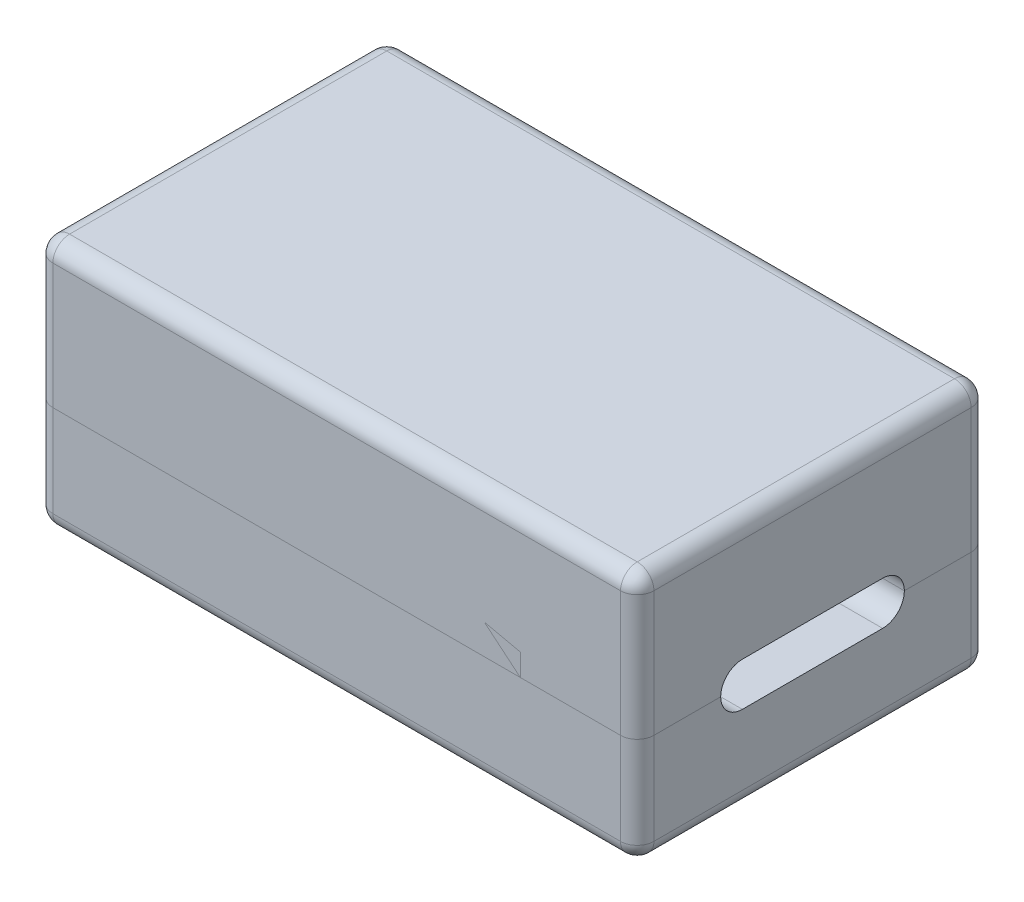
from build123d import *

# Parameters (mm, degrees)
SKETCH1_W           = 36
SKETCH1_H           = 21
BOSS_EXTRUDE2_DEPTH = 15
CUT_EXTRUDE1_DEPTH  = 15
SKETCH5_W           = 30
SKETCH5_H           = 15
CUT_EXTRUDE2_DEPTH  = 3.5
SKETCH7_W           = 30
SKETCH7_H           = 15
CUT_EXTRUDE3_DEPTH  = 5.5
FILLET1_R           = 1
FILLET2_R           = 1
SKETCH9_W           = 3
SKETCH9_H           = 3
BOSS_EXTRUDE3_DEPTH = 1
SKETCH9_4_W         = 3
SKETCH9_4_H         = 3
BOSS_EXTRUDE4_DEPTH = 1
SKETCH10_W          = 3
SKETCH10_H          = 1.5
BOSS_EXTRUDE5_DEPTH = 1
CUT_EXTRUDE4_DEPTH  = 35.296501279
SKETCH12_W          = 3
SKETCH12_H          = 6
BOSS_EXTRUDE6_DEPTH = 0.5
FILLET3_R           = 11
FILLET4_R           = 0.5
SKETCH17_W          = 3
SKETCH17_H          = 2
BOSS_EXTRUDE7_DEPTH = 1
SKETCH18_W          = 3
SKETCH18_H          = 1.5
BOSS_EXTRUDE8_DEPTH = 1
FILLET5_R           = 0.75
FILLET6_SIZE        = 1


# Some blends are built 0.0001 mm under size
with BuildPart() as part:
    # Sketch1 → Boss-Extrude2 (new body)
    with BuildSketch(Plane(origin=(0, 0, 0), x_dir=(1, 0, 0), z_dir=(0, 1, 0))):
        Rectangle(SKETCH1_W, SKETCH1_H)
    extrude(amount=BOSS_EXTRUDE2_DEPTH)

    # Sketch2 → Cut-Extrude1 (cut)
    with BuildSketch(Plane(origin=(18, 0, 0), x_dir=(0, 0, -1), z_dir=(1, 0, 0))):
        with BuildLine():
            Line((-4.2, 7.8), (4.2, 7.8))
            ThreePointArc((4.2, 7.8), (5.5, 6.5), (4.2, 5.2))
            Line((4.2, 5.2), (-4.2, 5.2))
            ThreePointArc((-4.2, 5.2), (-5.5, 6.5), (-4.2, 7.8))
        make_face()
    extrude(amount=-CUT_EXTRUDE1_DEPTH, mode=Mode.SUBTRACT)


with BuildPart() as body_2:
    # Split1: the piece on the far side of the plane
    add(part.part)
    split(bisect_by=Plane.ZX.offset(6.5), keep=Keep.BOTTOM)

    # Sketch5 → Cut-Extrude2 (cut)
    with BuildSketch(Plane(origin=(0, 6.5, 0), x_dir=(1, 0, 0), z_dir=(0, 1, 0))):
        Rectangle(SKETCH5_W, SKETCH5_H)
    extrude(amount=-CUT_EXTRUDE2_DEPTH, mode=Mode.SUBTRACT)

    # Fillet2
    fillet2_edges = [body_2.edges().sort_by_distance(p)[0] for p in [
        (18, 0, 0),
        (0, 0, -10.5),
        (-18, 0, 0),
        (0, 0, 10.5),
        (18, 3.25, 10.5),
        (-18, 3.25, 10.5),
        (-18, 3.25, -10.5),
        (18, 3.25, -10.5),
    ]]
    fillet(fillet2_edges, radius=FILLET2_R)

    # Sketch9 → Boss-Extrude3 (add)
    with BuildSketch(Plane.XY.offset(10.5)):
        with Locations((-9.5, 8)):
            Rectangle(SKETCH9_W, SKETCH9_H)
    extrude(amount=-BOSS_EXTRUDE3_DEPTH)

    # Sketch9<4> → Boss-Extrude4 (add)
    with BuildSketch(Plane.XY.offset(10.5)):
        with Locations((9.5, 8)):
            Rectangle(SKETCH9_4_W, SKETCH9_4_H)
    extrude(amount=-BOSS_EXTRUDE4_DEPTH)

    # Sketch10 → Boss-Extrude5 (add)
    with BuildSketch(Plane(origin=(0, 0, 9.5), x_dir=(-1, 0, 0), z_dir=(0, 0, -1))):
        with Locations((-9.5, 8.75)):
            Rectangle(SKETCH10_W, SKETCH10_H)
        with Locations((9.5, 8.75)):
            Rectangle(SKETCH10_W, SKETCH10_H)
    extrude(amount=BOSS_EXTRUDE5_DEPTH)

    # Sketch11 → Cut-Extrude4 (cut, through all)
    with BuildSketch(Plane(origin=(11, 0, 0), x_dir=(0, 0, -1), z_dir=(1, 0, 0))):
        Polygon((-9.5, 9.5), (-8.5, 8), (-8.5, 9.5), align=None)
    extrude(amount=-CUT_EXTRUDE4_DEPTH, mode=Mode.SUBTRACT)

    # Sketch12 → Boss-Extrude6 (add, symmetric)
    with BuildSketch(Plane(origin=(0, 0, -10.5), x_dir=(-1, 0, 0), z_dir=(0, 0, -1))):
        with Locations((0, 6.5)):
            Rectangle(SKETCH12_W, SKETCH12_H)
    extrude(amount=BOSS_EXTRUDE6_DEPTH, both=True)

    # Fillet3
    # the kernel refuses this fillet: 11 mm, written as the material it takes off along each edge
    with BuildSketch(Plane(origin=(-9.696798155, 3.5, -11), x_dir=(0, 0, 1), z_dir=(1, 0, 0))) as fillet3_piece_1:
        with BuildLine():
            CenterArc((11, -3.278719262), FILLET3_R, 162.658557197, 17.341442803)
            Line((0, -3.278719262), (-0.22, -3.278719262))
            Line((-0.22, -3.278719262), (-0.22, 0))
            Line((-0.22, 0), (0, 0.22))
            ThreePointArc((0, 0.22), (0.25, 0.22), (0.29, 0.065574385))
            Line((0.29, 0.065574385), (0.5, 0))
        make_face()
    extrude(amount=19.393596311, mode=Mode.SUBTRACT)

    # Fillet4
    fillet4_edges = [body_2.edges().sort_by_distance(p)[0] for p in [
        (-9.5, 9.5, 9.5),
        (9.5, 9.5, 9.5),
        (-9.5, 9.5, 10.5),
        (9.5, 9.5, 10.5),
    ]]
    fillet(fillet4_edges, radius=FILLET4_R)

    # Sketch17 → Boss-Extrude7 (add)
    with BuildSketch(Plane.XY.offset(-10)):
        with Locations((0, 10.5)):
            Rectangle(SKETCH17_W, SKETCH17_H)
    extrude(amount=-BOSS_EXTRUDE7_DEPTH)

    # Sketch18 → Boss-Extrude8 (add)
    with BuildSketch(Plane.XY.offset(-10)):
        with Locations((0, 9.25)):
            Rectangle(SKETCH18_W, SKETCH18_H)
    extrude(amount=BOSS_EXTRUDE8_DEPTH)

    # Fillet5
    fillet5_edges = [body_2.edges().sort_by_distance(p)[0] for p in [
        (0, 8.5, -9),
        (0, 10, -9),
    ]]
    fillet(fillet5_edges, radius=FILLET5_R - 0.0001)  # a hair under: the kernel refuses the full size

    # Fillet6
    # a fillet whose section is not a circle: 1 mm, written as the material it takes off along each edge
    with BuildSketch(Plane(origin=(4, 11.5, -10), x_dir=(0, -1, 0), z_dir=(-1, 0, 0))) as fillet6_piece_1:
        with BuildLine():
            Bezier((FILLET6_SIZE, 0), (0, 0), (0, -FILLET6_SIZE), weights=[1, 0.070710678, 1])
            Line((0, -FILLET6_SIZE), (0, 0))
            Line((0, 0), (FILLET6_SIZE, 0))
        make_face()
    extrude(amount=8, mode=Mode.SUBTRACT)


with BuildPart() as part_1:
    add(part.part)

    # Split1
    split(bisect_by=Plane.ZX.offset(6.5), keep=Keep.TOP)

    # Sketch7 → Cut-Extrude3 (cut)
    with BuildSketch(Plane.XZ.offset(-6.5)):
        Rectangle(SKETCH7_W, SKETCH7_H)
    extrude(amount=-CUT_EXTRUDE3_DEPTH, mode=Mode.SUBTRACT)

    # Fillet1
    fillet1_edges = [part_1.edges().sort_by_distance(p)[0] for p in [
        (-18, 15, 0),
        (0, 15, 10.5),
        (18, 15, 0),
        (18, 10.75, 10.5),
        (-18, 10.75, 10.5),
        (-18, 10.75, -10.5),
        (18, 10.75, -10.5),
        (0, 15, -10.5),
    ]]
    fillet(fillet1_edges, radius=FILLET1_R)


solid = Compound([body_2.part, part_1.part])
